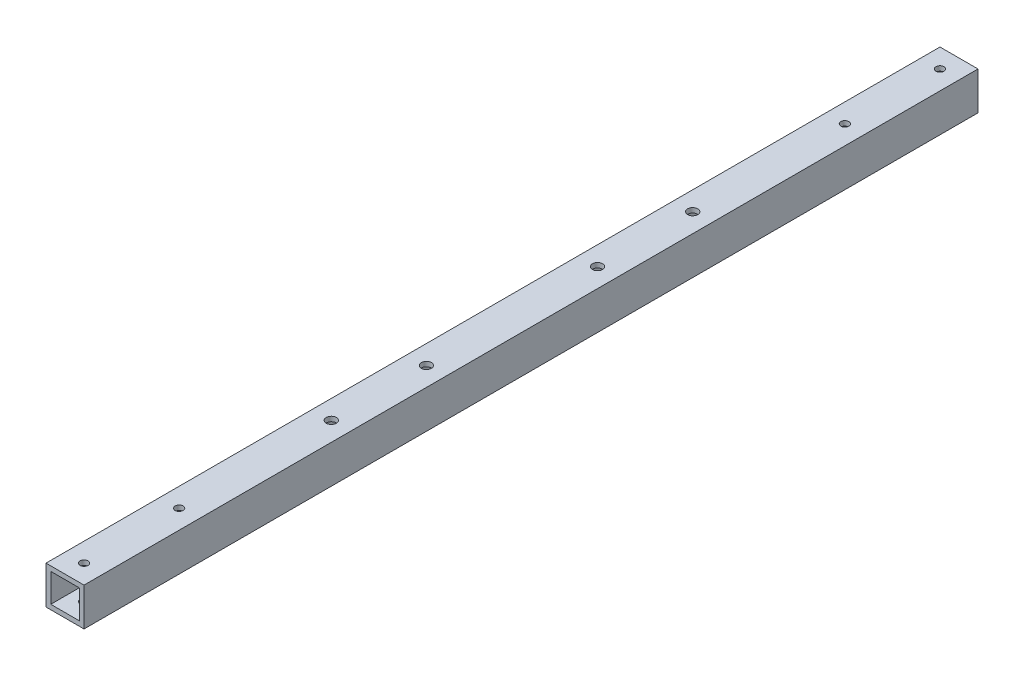
from build123d import *

# Parameters (mm, degrees)
SKETCH1_W           = 25.4
SKETCH1_H           = 25.4
SKETCH1_W_2         = 19.05
SKETCH1_H_2         = 19.05
BOSS_EXTRUDE1_DEPTH = 596.9
SKETCH2_R           = 2.667
CUT_EXTRUDE1_DEPTH  = 598.979874243
SKETCH4_R           = 3.3782
CUT_EXTRUDE3_DEPTH  = 25.4


with BuildPart() as part:
    # Sketch1 → Boss-Extrude1 (new body)
    with BuildSketch(Plane.XY):
        with Locations((12.7, 12.7)):
            Rectangle(SKETCH1_W, SKETCH1_H)
        with Locations((12.7, 12.7)):
            Rectangle(SKETCH1_W_2, SKETCH1_H_2, mode=Mode.SUBTRACT)
    extrude(amount=BOSS_EXTRUDE1_DEPTH)

    # Sketch2 → Cut-Extrude1 (cut, through all)
    with BuildSketch(Plane(origin=(0, 25.4, 0), x_dir=(1, 0, 0), z_dir=(0, 1, 0))):
        with Locations((12.7, -584.2)):
            Circle(SKETCH2_R)
        with Locations((12.7, -12.7)):
            Circle(SKETCH2_R)
        with Locations((12.7, -520.7)):
            Circle(SKETCH2_R)
        with Locations((12.7, -76.2)):
            Circle(SKETCH2_R)
    extrude(amount=-CUT_EXTRUDE1_DEPTH, mode=Mode.SUBTRACT)

    # Sketch4 → Cut-Extrude3 (cut)
    with BuildSketch(Plane(origin=(0, 25.4, 0), x_dir=(1, 0, 0), z_dir=(0, 1, 0))):
        with Locations((12.7, -419.1)):
            Circle(SKETCH4_R)
        with Locations((12.7, -355.6)):
            Circle(SKETCH4_R)
        with Locations((12.7, -177.8)):
            Circle(SKETCH4_R)
        with Locations((12.7, -241.3)):
            Circle(SKETCH4_R)
    extrude(amount=-CUT_EXTRUDE3_DEPTH, mode=Mode.SUBTRACT)


solid = part.part
